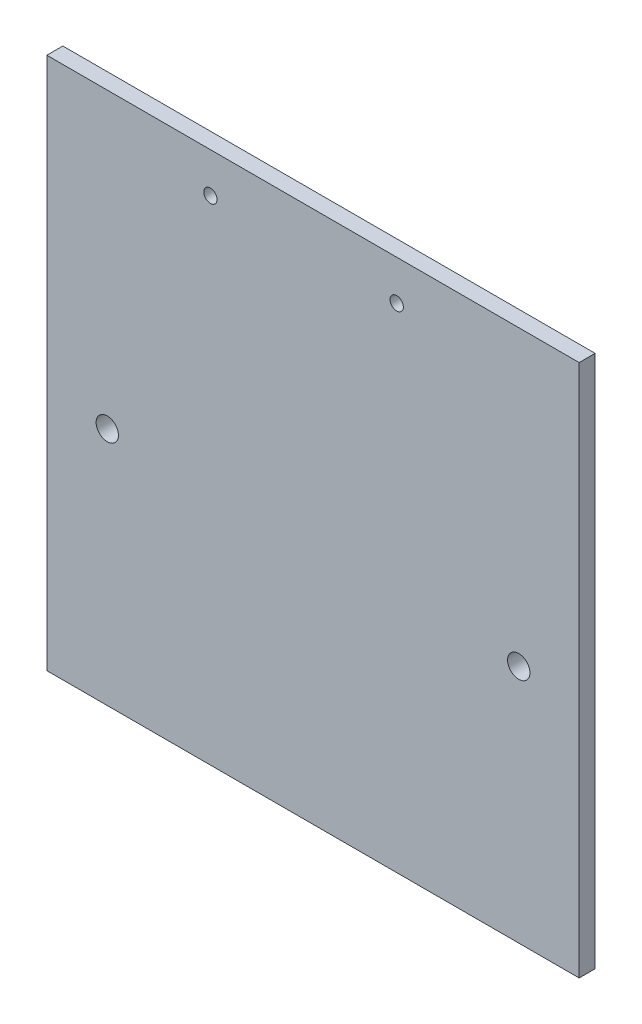
from build123d import *

# Parameters (mm, degrees)
SKETCH_1_W          = 100
SKETCH_1_H          = 187
EXTRUDE_1_DEPTH     = 3
SKETCH_2_R          = 2.1
CUT_EXTRUDE_1_DEPTH = 10
SKETCH_3_R          = 1.25
CUT_EXTRUDE_2_DEPTH = 10
SKETCH_5_W          = 100
SKETCH_5_H          = 24.687890103
CUT_EXTRUDE_3_DEPTH = 10
SKETCH_6_W          = 100
SKETCH_6_H          = 62.179114242
CUT_EXTRUDE_4_DEPTH = 10


with BuildPart() as part:
    # 草图1 → 凸台-拉伸1 (new body)
    with BuildSketch(Plane.XY):
        Rectangle(SKETCH_1_W, SKETCH_1_H)
    extrude(amount=EXTRUDE_1_DEPTH)

    # 草图2 → 切除-拉伸1 (cut)
    with BuildSketch(Plane.XY.offset(3)):
        with Locations((-38.649646671, 13.699114242)):
            Circle(SKETCH_2_R)
        with Locations((38.649646671, 13.699114242)):
            Circle(SKETCH_2_R)
    extrude(amount=-CUT_EXTRUDE_1_DEPTH, mode=Mode.SUBTRACT)

    # 草图3 → 切除-拉伸2 (cut)
    with BuildSketch(Plane.XY.offset(3)):
        with Locations((-19.278349701, 61.312109897)):
            Circle(SKETCH_3_R)
        with Locations((15.721650299, 61.312109897)):
            Circle(SKETCH_3_R)
    extrude(amount=-CUT_EXTRUDE_2_DEPTH, mode=Mode.SUBTRACT)

    # 草图5 → 切除-拉伸3 (cut)
    with BuildSketch(Plane.XY.offset(3)):
        with Locations((0, 81.156054948)):
            Rectangle(SKETCH_5_W, SKETCH_5_H)
    extrude(amount=-CUT_EXTRUDE_3_DEPTH, mode=Mode.SUBTRACT)

    # 草图6 → 切除-拉伸4 (cut)
    with BuildSketch(Plane.XY.offset(3)):
        with Locations((0, -62.410442879)):
            Rectangle(SKETCH_6_W, SKETCH_6_H)
    extrude(amount=-CUT_EXTRUDE_4_DEPTH, mode=Mode.SUBTRACT)


solid = part.part
